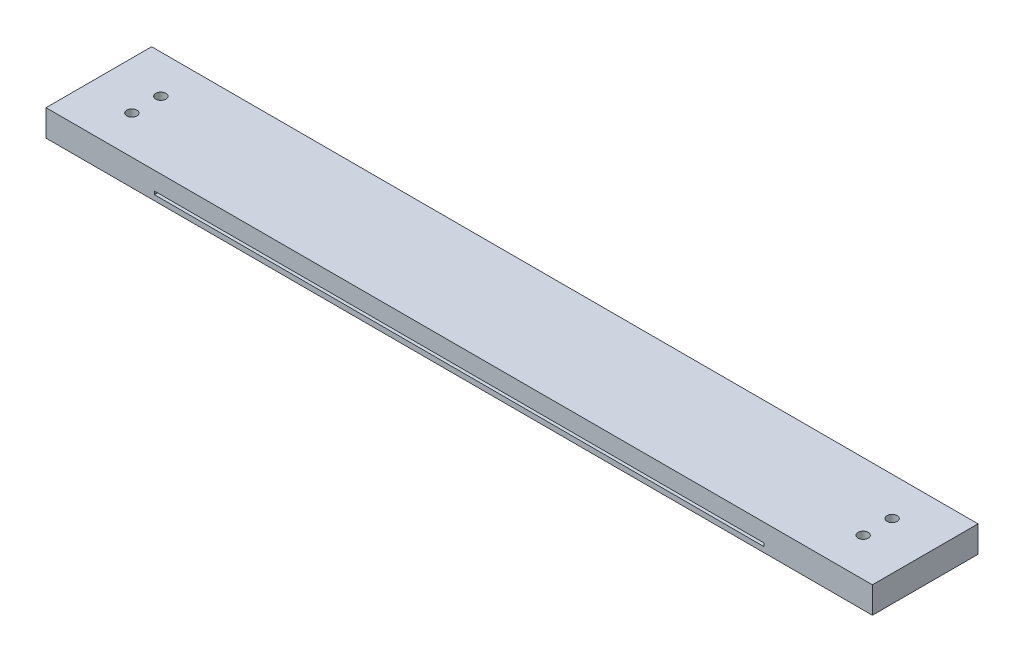
from build123d import *

# Parameters (mm, degrees)
SKETCH1_W           = 40
SKETCH1_H           = 10
BOSS_EXTRUDE1_DEPTH = 312.997959
SKETCH2_W           = 230.9
SKETCH2_H           = 1.2
CUT_EXTRUDE1_DEPTH  = 316.701951749
SKETCH3_R           = 1.9177
CUT_EXTRUDE2_DEPTH  = 316.701951749
CUT_EXTRUDE3_DEPTH  = 4.3


with BuildPart() as part:
    # Sketch1 → Boss-Extrude1 (new body)
    with BuildSketch(Plane(origin=(0, 0, 0), x_dir=(0, 0, -1), z_dir=(1, 0, 0))):
        with Locations((20, 5)):
            Rectangle(SKETCH1_W, SKETCH1_H)
    extrude(amount=BOSS_EXTRUDE1_DEPTH)

    # Sketch2 → Cut-Extrude1 (cut, through all)
    with BuildSketch(Plane(origin=(0, 0, -40), x_dir=(-1, 0, 0), z_dir=(0, 0, -1))):
        with Locations((-156.4989795, 2.6)):
            Rectangle(SKETCH2_W, SKETCH2_H)
    extrude(amount=-CUT_EXTRUDE1_DEPTH, mode=Mode.SUBTRACT)

    # Sketch3 → Cut-Extrude2 (cut, through all)
    with BuildSketch(Plane(origin=(0, 10, 0), x_dir=(1, 0, 0), z_dir=(0, 1, 0))):
        with Locations((294.997959, 25.5)):
            Circle(SKETCH3_R)
        with Locations((294.997959, 14.5)):
            Circle(SKETCH3_R)
        with Locations((18, 14.5)):
            Circle(SKETCH3_R)
        with Locations((18, 25.5)):
            Circle(SKETCH3_R)
    extrude(amount=-CUT_EXTRUDE2_DEPTH, mode=Mode.SUBTRACT)

    # Sketch4 → Cut-Extrude3 (cut)
    with BuildSketch(Plane.XZ):
        Polygon((14.5837, -12.527598275), (14.5837, -16.472401725), (18, -18.444803449), (21.4163, -16.472401725), (21.4163, -12.527598275), (18, -10.555196551), align=None)
        Polygon((14.5837, -23.527598275), (14.5837, -27.472401725), (18, -29.444803449), (21.4163, -27.472401725), (21.4163, -23.527598275), (18, -21.555196551), align=None)
        Polygon((298.414259, -12.527598275), (294.997959, -10.555196551), (291.581659, -12.527598275), (291.581659, -16.472401725), (294.997959, -18.444803449), (298.414259, -16.472401725), align=None)
        Polygon((291.581659, -23.527598275), (291.581659, -27.472401725), (294.997959, -29.444803449), (298.414259, -27.472401725), (298.414259, -23.527598275), (294.997959, -21.555196551), align=None)
    extrude(amount=-CUT_EXTRUDE3_DEPTH, mode=Mode.SUBTRACT)


solid = part.part
